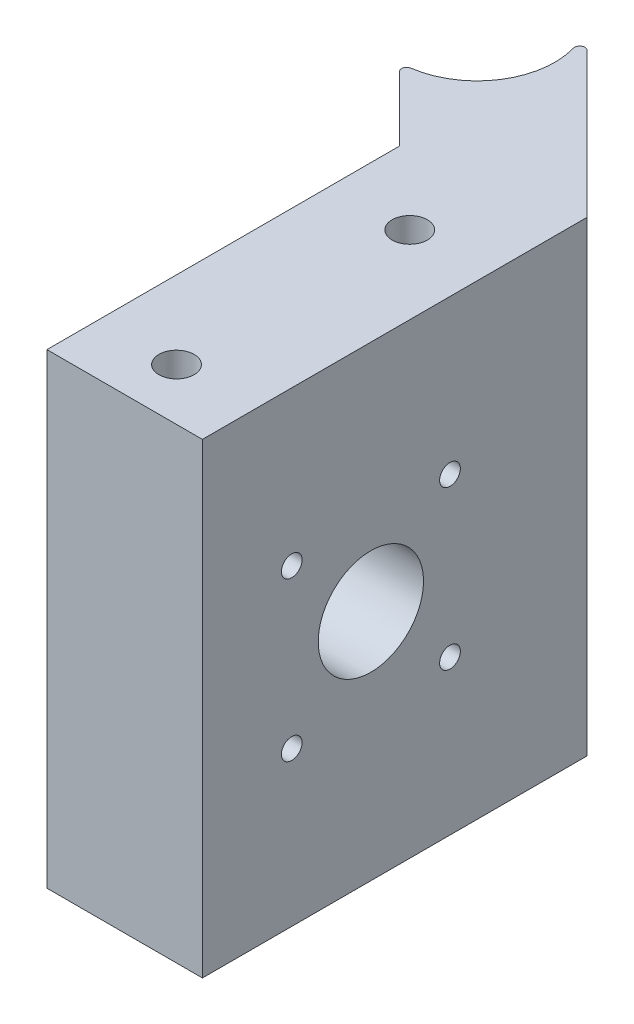
from build123d import *

# Parameters (mm, degrees)
SKETCH1_R           = 1.7
BOSS_EXTRUDE1_DEPTH = 45
CUT_EXTRUDE1_REACH  = 71.934
SKETCH2_R           = 5.0800000000000045
SKETCH2_R_2         = 1.0000000000000009
SKETCH2_R_3         = 1.0000000000000018
FILLET1_R           = 0.5
CUT_EXTRUDE2_DEPTH  = 2
CUT_EXTRUDE3_START  = 17
CUT_EXTRUDE3_DEPTH  = 2


with BuildPart() as part:
    # Sketch1 → Boss-Extrude1 (new body)
    with BuildSketch(Plane(origin=(0, 0, 0), x_dir=(1, 0, 0), z_dir=(0, 1, 0))):
        with BuildLine():
            Line((-7.499999999999999, -5.000000000000001), (7.500000000000001, -4.999999999999999))
            Line((7.500000000000001, -5), (7.499999999999998, 32.10660171779804))
            Line((7.499999999999998, 32.10660171779804), (-9.196699141100867, 48.80330085889908))
            ThreePointArc((-9.196699141100867, 48.80330085889908), (-7.57090350616536, 40.62987425726181), (-14.499999999999998, 36))
            Line((-14.499999999999998, 36), (-7.5, 28.999999999999925))
            Line((-7.5, 28.99999999999993), (-7.499999999999999, -5.000000000000001))
        make_face()
        Circle(SKETCH1_R, mode=Mode.SUBTRACT)
        with Locations((0, 22.5)):
            Circle(SKETCH1_R, mode=Mode.SUBTRACT)
    extrude(amount=BOSS_EXTRUDE1_DEPTH)

    # Sketch2 → Cut-Extrude1 (cut, up to next)
    with BuildSketch(Plane(origin=(7.5, 0, -8.8e-16), x_dir=(-1.2e-16, 0, -1), z_dir=(1, 0, -1.2e-16)), mode=Mode.PRIVATE) as cut_extrude1_sk1:
        with Locations((11.25, 22.5)):
            Circle(SKETCH2_R)
    cut_extrude1_tool1 = extrude(cut_extrude1_sk1.sketch, amount=-CUT_EXTRUDE1_REACH, mode=Mode.PRIVATE) & part.part
    # Sketch2 → Cut-Extrude1 (cut, up to next)
    with BuildSketch(Plane(origin=(7.5, 0, -8.8e-16), x_dir=(-1.2e-16, 0, -1), z_dir=(1, 0, -1.2e-16)), mode=Mode.PRIVATE) as cut_extrude1_sk2:
        with Locations((3.616999999999997, 30.133)):
            Circle(SKETCH2_R_2)
    cut_extrude1_tool2 = extrude(cut_extrude1_sk2.sketch, amount=-CUT_EXTRUDE1_REACH, mode=Mode.PRIVATE) & part.part
    # Sketch2 → Cut-Extrude1 (cut, up to next)
    with BuildSketch(Plane(origin=(7.5, 0, -8.8e-16), x_dir=(-1.2e-16, 0, -1), z_dir=(1, 0, -1.2e-16)), mode=Mode.PRIVATE) as cut_extrude1_sk3:
        with Locations((18.882999999999996, 30.133)):
            Circle(SKETCH2_R_3)
    cut_extrude1_tool3 = extrude(cut_extrude1_sk3.sketch, amount=-CUT_EXTRUDE1_REACH, mode=Mode.PRIVATE) & part.part
    # Sketch2 → Cut-Extrude1 (cut, up to next)
    with BuildSketch(Plane(origin=(7.5, 0, -8.8e-16), x_dir=(-1.2e-16, 0, -1), z_dir=(1, 0, -1.2e-16)), mode=Mode.PRIVATE) as cut_extrude1_sk4:
        with Locations((18.883, 14.867)):
            Circle(SKETCH2_R_3)
    cut_extrude1_tool4 = extrude(cut_extrude1_sk4.sketch, amount=-CUT_EXTRUDE1_REACH, mode=Mode.PRIVATE) & part.part
    # Sketch2 → Cut-Extrude1 (cut, up to next)
    with BuildSketch(Plane(origin=(7.5, 0, -8.8e-16), x_dir=(-1.2e-16, 0, -1), z_dir=(1, 0, -1.2e-16)), mode=Mode.PRIVATE) as cut_extrude1_sk5:
        with Locations((3.6169999999999987, 14.867)):
            Circle(SKETCH2_R_2)
    cut_extrude1_tool5 = extrude(cut_extrude1_sk5.sketch, amount=-CUT_EXTRUDE1_REACH, mode=Mode.PRIVATE) & part.part
    add(cut_extrude1_tool1.solids().sort_by_distance((7.5, 22.5, -11.25))[0], mode=Mode.SUBTRACT)
    add(cut_extrude1_tool2.solids().sort_by_distance((7.5, 30.133, -3.617))[0], mode=Mode.SUBTRACT)
    add(cut_extrude1_tool3.solids().sort_by_distance((7.5, 30.133, -18.883))[0], mode=Mode.SUBTRACT)
    add(cut_extrude1_tool4.solids().sort_by_distance((7.5, 14.867, -18.883))[0], mode=Mode.SUBTRACT)
    add(cut_extrude1_tool5.solids().sort_by_distance((7.5, 14.867, -3.617))[0], mode=Mode.SUBTRACT)

    # Fillet1
    fillet1_edges = [part.edges().sort_by_distance(p)[0] for p in [
        (-9.196699141100865, 22.5, -48.80330085889908),
        (-14.499999999999998, 22.5, -36),
    ]]
    fillet(fillet1_edges, radius=FILLET1_R)

    # Sketch3 → Cut-Extrude2 (cut, symmetric)
    with BuildSketch(Plane(origin=(0, 22.5, 0), x_dir=(1, 0, 0), z_dir=(0, 1, 0))):
        with BuildLine():
            Line((-8.136038969321103, 37.136038969321035), (-2.832738110421976, 42.43933982822012))
            Line((-2.832738110421976, 42.43933982822012), (-1.7720779386421608, 41.37867965644029))
            Line((-1.7720779386421608, 41.37867965644029), (-7.075378797541292, 36.07537879754122))
            ThreePointArc((-7.075378797541292, 36.07537879754122), (-9.276718417433415, 34.39135962345529), (-11.841997191011883, 33.34199719101184))
            Line((-11.841997191011883, 33.34199719101184), (-13.108259049699228, 34.608259049699214))
            ThreePointArc((-13.108259049699228, 34.608259049699214), (-10.42137938330202, 35.47722904072127), (-8.136038969321103, 37.136038969321035))
        make_face()
    extrude(amount=CUT_EXTRUDE2_DEPTH, both=True, mode=Mode.SUBTRACT)

    # Sketch3<2> → Cut-Extrude3 (cut, symmetric)
    with BuildSketch(Plane(origin=(0, 22.5, 0), x_dir=(1, 0, 0), z_dir=(0, 1, 0)).offset(CUT_EXTRUDE3_START)):
        with BuildLine():
            Line((-8.136038969321103, 37.136038969321035), (-2.832738110421976, 42.43933982822012))
            Line((-2.832738110421976, 42.43933982822012), (-1.7720779386421608, 41.37867965644029))
            Line((-1.7720779386421608, 41.37867965644029), (-7.075378797541292, 36.07537879754122))
            ThreePointArc((-7.075378797541292, 36.07537879754122), (-9.276718417433415, 34.39135962345529), (-11.841997191011883, 33.34199719101184))
            Line((-11.841997191011883, 33.34199719101184), (-13.108259049699228, 34.608259049699214))
            ThreePointArc((-13.108259049699228, 34.608259049699214), (-10.42137938330202, 35.47722904072127), (-8.136038969321103, 37.136038969321035))
        make_face()
    cut_extrude3 = extrude(amount=CUT_EXTRUDE3_DEPTH, both=True, mode=Mode.SUBTRACT)

    # Mirror1: Cut-Extrude3 across plane
    add(cut_extrude3.mirror(Plane.ZX.offset(22.5)), mode=Mode.SUBTRACT)


solid = part.part
